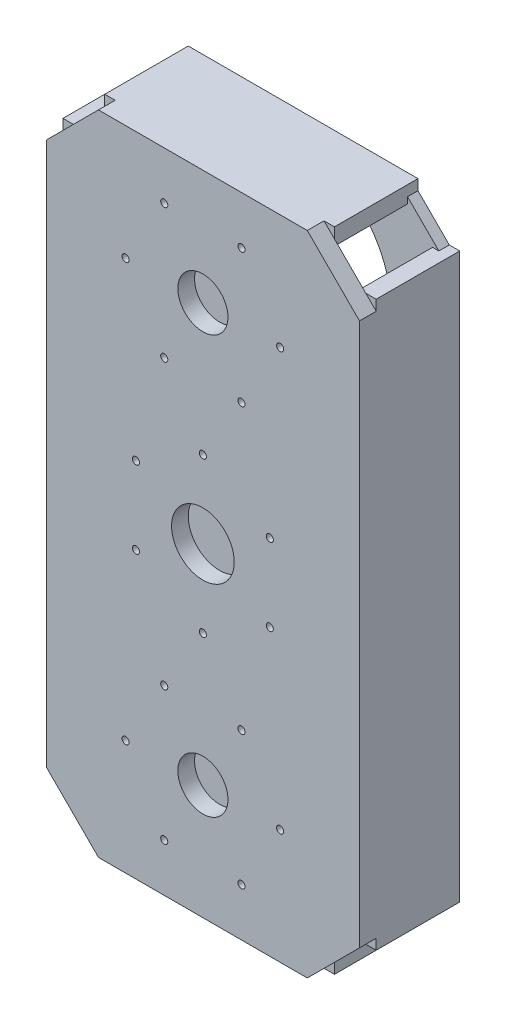
from build123d import *

# Parameters (mm, degrees)
SK_TOP_PLATE_R      = 1.7
SK_TOP_PLATE_R_2    = 12
SK_TOP_PLATE_R_3    = 15
TOP_PLATE_DEPTH     = 8
SK_FRONT_WALL_W     = 40
SK_FRONT_WALL_H     = 270
FRONT_WALL_DEPTH    = 8
SK_BACK_WALL_W      = 40
SK_BACK_WALL_H      = 270
BACK_WALL_DEPTH     = 8
SK_LEFT_WALL_W      = 110
SK_LEFT_WALL_H      = 40
LEFT_WALL_DEPTH     = 8
SK_RIGHT_WALL_W     = 110
SK_RIGHT_WALL_H     = 40
RIGHT_WALL_DEPTH    = 8
SK_BOTTOM_PLATE_R   = 47
SK_BOTTOM_PLATE_R_2 = 20
BOTTOM_PLATE_DEPTH  = 5


with BuildPart() as part:
    # SK_Top_Plate → Top_Plate (new body)
    with BuildSketch(Plane.XY.offset(124)):
        Polygon((-50, -155), (50, -155), (75, -130), (75, 130), (50, 155), (-50, 155), (-75, 130), (-75, -130), align=None)
        with Locations((37, 100)):
            Circle(SK_TOP_PLATE_R, mode=Mode.SUBTRACT)
        with Locations((18.5, 132.04293994)):
            Circle(SK_TOP_PLATE_R, mode=Mode.SUBTRACT)
        with Locations((-18.5, 132.04293994)):
            Circle(SK_TOP_PLATE_R, mode=Mode.SUBTRACT)
        with Locations((-37, 100)):
            Circle(SK_TOP_PLATE_R, mode=Mode.SUBTRACT)
        with Locations((-18.5, 67.95706006)):
            Circle(SK_TOP_PLATE_R, mode=Mode.SUBTRACT)
        with Locations((18.5, 67.95706006)):
            Circle(SK_TOP_PLATE_R, mode=Mode.SUBTRACT)
        with Locations((0, 100)):
            Circle(SK_TOP_PLATE_R_2, mode=Mode.SUBTRACT)
        with Locations((37, -100)):
            Circle(SK_TOP_PLATE_R, mode=Mode.SUBTRACT)
        with Locations((18.5, -67.95706006)):
            Circle(SK_TOP_PLATE_R, mode=Mode.SUBTRACT)
        with Locations((-18.5, -67.95706006)):
            Circle(SK_TOP_PLATE_R, mode=Mode.SUBTRACT)
        with Locations((-37, -100)):
            Circle(SK_TOP_PLATE_R, mode=Mode.SUBTRACT)
        with Locations((-18.5, -132.04293994)):
            Circle(SK_TOP_PLATE_R, mode=Mode.SUBTRACT)
        with Locations((18.5, -132.04293994)):
            Circle(SK_TOP_PLATE_R, mode=Mode.SUBTRACT)
        with Locations((0, -100)):
            Circle(SK_TOP_PLATE_R_2, mode=Mode.SUBTRACT)
        with Locations((32.04293994, 18.5)):
            Circle(SK_TOP_PLATE_R, mode=Mode.SUBTRACT)
        with Locations((0, 37)):
            Circle(SK_TOP_PLATE_R, mode=Mode.SUBTRACT)
        with Locations((-32.04293994, 18.5)):
            Circle(SK_TOP_PLATE_R, mode=Mode.SUBTRACT)
        with Locations((-32.04293994, -18.5)):
            Circle(SK_TOP_PLATE_R, mode=Mode.SUBTRACT)
        with Locations((0, -37)):
            Circle(SK_TOP_PLATE_R, mode=Mode.SUBTRACT)
        with Locations((32.04293994, -18.5)):
            Circle(SK_TOP_PLATE_R, mode=Mode.SUBTRACT)
        Circle(SK_TOP_PLATE_R_3, mode=Mode.SUBTRACT)
    extrude(amount=TOP_PLATE_DEPTH)

    # SK_Front_Wall → Front_Wall (add)
    with BuildSketch(Plane(origin=(67, 0, 0), x_dir=(0, 0, -1), z_dir=(1, 0, 0))):
        with Locations((-104, 0)):
            Rectangle(SK_FRONT_WALL_W, SK_FRONT_WALL_H)
    extrude(amount=FRONT_WALL_DEPTH)

    # SK_Back_Wall → Back_Wall (add)
    with BuildSketch(Plane(origin=(-75, 0, 0), x_dir=(0, 0, -1), z_dir=(1, 0, 0))):
        with Locations((-104, 0)):
            Rectangle(SK_BACK_WALL_W, SK_BACK_WALL_H)
    extrude(amount=BACK_WALL_DEPTH)

    # SK_Left_Wall → Left_Wall (add)
    with BuildSketch(Plane(origin=(0, 147, 0), x_dir=(1, 0, 0), z_dir=(0, 1, 0))):
        with Locations((0, -104)):
            Rectangle(SK_LEFT_WALL_W, SK_LEFT_WALL_H)
    extrude(amount=LEFT_WALL_DEPTH)

    # SK_Right_Wall → Right_Wall (add)
    with BuildSketch(Plane(origin=(0, -155, 0), x_dir=(1, 0, 0), z_dir=(0, 1, 0))):
        with Locations((0, -104)):
            Rectangle(SK_RIGHT_WALL_W, SK_RIGHT_WALL_H)
    extrude(amount=RIGHT_WALL_DEPTH)

    # SK_Bottom_Plate → Bottom_Plate (add)
    with BuildSketch(Plane.XY.offset(84)):
        Polygon((-50, -155), (50, -155), (75, -130), (75, 130), (50, 155), (-50, 155), (-75, 130), (-75, -130), align=None)
        with Locations((0, 100)):
            Circle(SK_BOTTOM_PLATE_R, mode=Mode.SUBTRACT)
        with Locations((0, -100)):
            Circle(SK_BOTTOM_PLATE_R, mode=Mode.SUBTRACT)
        Circle(SK_BOTTOM_PLATE_R_2, mode=Mode.SUBTRACT)
    extrude(amount=BOTTOM_PLATE_DEPTH)


solid = part.part
